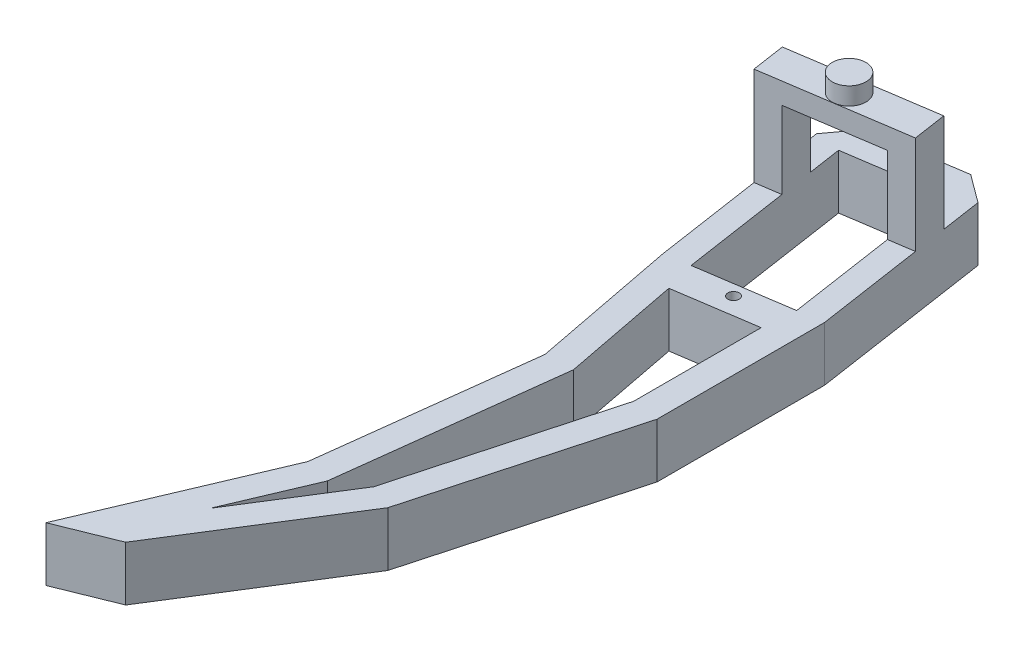
from build123d import *

# Parameters (mm, degrees)
BOSS_EXTRUDE1_DEPTH = 5
SCALE2_SCALE        = 1.55
CUT_EXTRUDE1_DEPTH  = 12.4
BOSS_EXTRUDE3_DEPTH = 7.75
SKETCH9_W           = 20.224703408
SKETCH9_H           = 7.75
BOSS_EXTRUDE4_DEPTH = 29.5
CUT_EXTRUDE2_DEPTH  = 12.4
CHAMFER1_SIZE       = 3.5
CHAMFER2_SIZE       = 3.5
SKETCH11_R          = 0.8
CUT_EXTRUDE3_DEPTH  = 12.4
SKETCH12_R          = 0.8
CUT_EXTRUDE4_DEPTH  = 12.4
BOSS_EXTRUDE5_DEPTH = 14
SKETCH18_W          = 12
SKETCH18_H          = 3
BOSS_EXTRUDE6_DEPTH = 14
SKETCH19_R          = 2.4
BOSS_EXTRUDE7_DEPTH = 2.5
SKETCH22_W          = 3.6
SKETCH22_H          = 14
CUT_EXTRUDE5_DEPTH  = 21


with BuildPart() as part:
    # Sketch2 → Boss-Extrude1 (new body)
    with BuildSketch(Plane(origin=(0, 0, 0), x_dir=(1, 0, 0), z_dir=(0, 1, 0))):
        Polygon((-16.722011876, -36.89474357), (-23.886628792, -53.795891167), (-18.669768773, -51.685253144), (-9.373686833, -36.89474357), (-4.046151178, -17.471336145), (-4.046151178, -4.010989005), (-16.95, -4.010989005), (-14.350773449, -17.46691156), align=None)
        Polygon((-13.920870812, -6.510989005), (-6.546151178, -6.510989005), (-6.546151178, -17.13469746), (-11.686920269, -35.877181599), (-17.487790608, -45.106642876), (-14.283033348, -37.546702673), (-11.821510253, -17.379157883), align=None, mode=Mode.SUBTRACT)
    extrude(amount=BOSS_EXTRUDE1_DEPTH)


with BuildPart() as part_1:
    # Scale2: scaled about (-12.587588719, 2.5, 26.875435477)
    add(part.part.scale(SCALE2_SCALE).moved(Location((6.923173795, -1.375, -14.781489512))))

    # Sketch6 → Cut-Extrude1 (cut)
    with BuildSketch(Plane(origin=(0, 6.375, 0), x_dir=(1, 0, 0), z_dir=(0, 1, 0))):
        Polygon((-3.22336053, 6.403996086), (-14.654175964, 4.689456555), (-3.22336053, 4.689456555), align=None)
    extrude(amount=-CUT_EXTRUDE1_DEPTH, mode=Mode.SUBTRACT)

    # Sketch7 → Boss-Extrude3 (add)
    with BuildSketch(Plane(origin=(0, 6.375, 0), x_dir=(1, 0, 0), z_dir=(0, 1, 0))):
        Polygon((-19.349326204, 8.564456555), (0.65163947, 8.564456555), (0.65163947, 11.564456555), align=None)
    extrude(amount=-BOSS_EXTRUDE3_DEPTH)

    # Sketch9 → Boss-Extrude4 (add)
    with BuildSketch(Plane(origin=(-1.682081089, 0, -11.214415372), x_dir=(-0.9889374035171397, 0, 0.1483334484355372), z_dir=(-0.14833344843553717, 0, -0.9889374035171395))):
        with Locations((7.752525338, 2.5)):
            Rectangle(SKETCH9_W, SKETCH9_H)
    extrude(amount=BOSS_EXTRUDE4_DEPTH)

    # Sketch10 → Cut-Extrude2 (cut)
    with BuildSketch(Plane(origin=(0, 6.375, 0), x_dir=(1, 0, 0), z_dir=(0, 1, 0))):
        Polygon((-6.517977653, 35.768724573), (-19.596381503, 33.807058712), (-15.888045292, 9.083623624), (-2.809641442, 11.045289485), align=None)
    extrude(amount=-CUT_EXTRUDE2_DEPTH, mode=Mode.SUBTRACT)

    # Chamfer1
    chamfer1_edges = [part_1.edges().sort_by_distance(p)[0] for p in [
        (-23.725162933, 2.5, -37.738109959),
    ]]
    chamfer(chamfer1_edges, length=CHAMFER1_SIZE)

    # Chamfer2
    chamfer2_edges = [part_1.edges().sort_by_distance(p)[0] for p in [
        (-3.724197259, 2.5, -40.738109959),
    ]]
    chamfer(chamfer2_edges, length=CHAMFER2_SIZE)

    # Sketch11 → Cut-Extrude3 (cut)
    with BuildSketch(Plane(origin=(0, 6.375, 0), x_dir=(1, 0, 0), z_dir=(0, 1, 0))):
        with Locations((-13.316763113, 36.518532099)):
            Circle(SKETCH11_R)
    extrude(amount=-CUT_EXTRUDE3_DEPTH, mode=Mode.SUBTRACT)

    # Sketch12 → Cut-Extrude4 (cut)
    with BuildSketch(Plane(origin=(0, 6.375, 0), x_dir=(1, 0, 0), z_dir=(0, 1, 0))):
        with Locations((-9.089259832, 8.333816099)):
            Circle(SKETCH12_R)
    extrude(amount=-CUT_EXTRUDE4_DEPTH, mode=Mode.SUBTRACT)

    # Sketch17 → Boss-Extrude5 (add)
    with BuildSketch(Plane(origin=(0, 6.375, 0), x_dir=(1, 0, 0), z_dir=(0, 1, 0))):
        Polygon((-17.638379984, 20.753084986), (-19.418381365, 32.620333828), (-22.879662277, 32.101166759), (-21.099660896, 20.233917916), align=None)
        Polygon((-2.878696603, 35.101166759), (-6.339977515, 34.581999689), (-4.559976134, 22.714750847), (-1.098695221, 23.233917916), align=None)
    extrude(amount=BOSS_EXTRUDE5_DEPTH)

    # Sketch18 → Boss-Extrude6 (add)
    with BuildSketch(Plane(origin=(-14.205964203, 0, 2.130791748), x_dir=(-0.1483334484355373, 0, -0.9889374035171397), z_dir=(0.9889374035171395, 0, -0.14833344843553728))):
        with Locations((29.139863709, 18.875)):
            Rectangle(SKETCH18_W, SKETCH18_H)
    extrude(amount=BOSS_EXTRUDE6_DEPTH)

    # Sketch19 → Boss-Extrude7 (add)
    with BuildSketch(Plane(origin=(0, 20.375, 0), x_dir=(1, 0, 0), z_dir=(0, 1, 0))):
        with Locations((-11.989048632, 27.694039925)):
            Circle(SKETCH19_R)
    extrude(amount=BOSS_EXTRUDE7_DEPTH)

    # Sketch22 → Cut-Extrude5 (cut)
    with BuildSketch(Plane(origin=(-17.667245116, 0, 2.649958817), x_dir=(0.1483334484355372, 0, 0.9889374035171397), z_dir=(-0.9889374035171395, 0, 0.14833344843553717))):
        with Locations((-24.939863709, 13.375)):
            Rectangle(SKETCH22_W, SKETCH22_H)
        with Locations((-33.339863709, 13.375)):
            Rectangle(SKETCH22_W, SKETCH22_H)
    extrude(amount=-CUT_EXTRUDE5_DEPTH, mode=Mode.SUBTRACT)


solid = part_1.part
